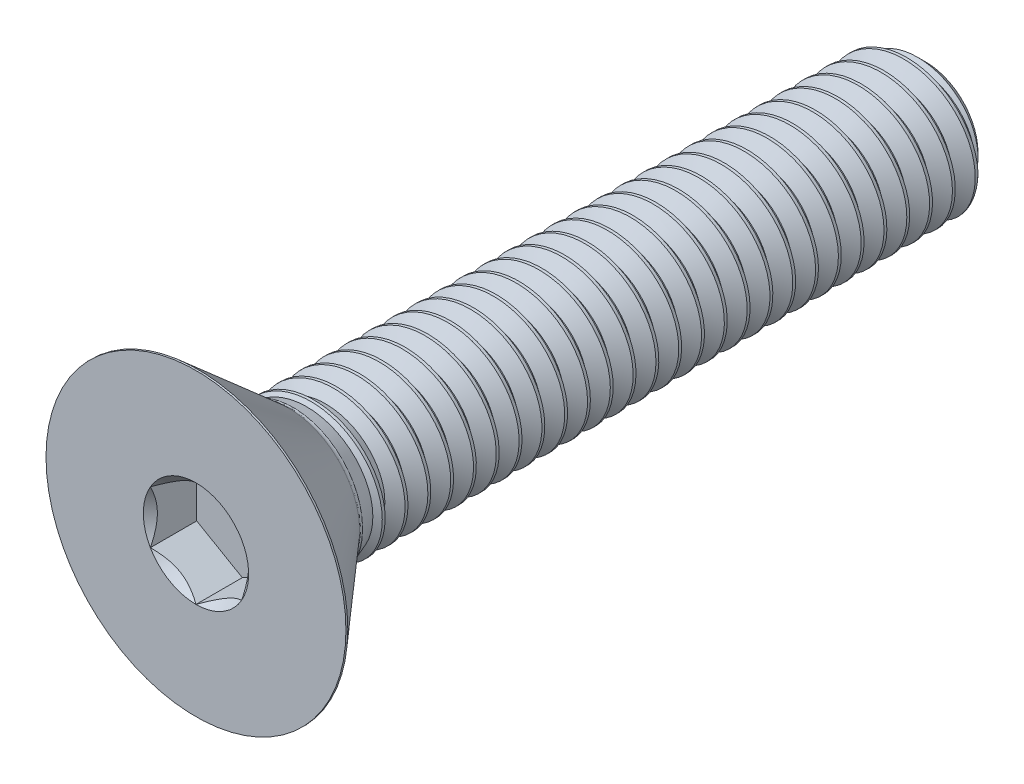
from build123d import *

# Parameters (mm, degrees)
SKETCH5_R          = 1.833087105
CUT_EXTRUDE1_DEPTH = 1.6129
CUT_EXTRUDE1_DRAFT = -45
CUT_EXTRUDE2_DEPTH = 1.6129
CUT_SWEEP1_PITCH   = 0.79375
CUT_SWEEP1_TO      = 22.017366


with BuildPart() as part:
    # Sketch3 → Revolve1 (revolve)
    with BuildSketch(Plane(origin=(0, 0, 0), x_dir=(0, 0, -1), z_dir=(1, 0, 0)), mode=Mode.PRIVATE) as revolve1_sk:
        with BuildLine():
            Line((-12.635484, 5.2197), (-9.4742, 2.471637744))
            ThreePointArc((-9.4742, 2.471637744), (-9.40108483, 2.428138789), (-9.317366229, 2.413))
            Line((-9.317366229, 2.413), (12.1046875, 2.413))
            Line((12.1046875, 2.413), (12.7, 1.8176875))
            Line((12.7, 1.8176875), (12.7, 0))
            Line((12.7, 0), (-12.7, 0))
            Line((-12.7, 0), (-12.7, 5.2197))
            Line((-12.7, 5.2197), (-12.635484, 5.2197))
        make_face()
    revolve(revolve1_sk.sketch.rotate(Axis((0, 0, -12.7), (0, 0, 1)), 90), axis=Axis((0, 0, -12.7), (0, 0, 1)))


with BuildPart() as cut_extrude1_tool:
    # Sketch5 → Cut-Extrude1 (with draft: the straight prism first)
    with BuildSketch(Plane.XY.offset(12.7)):
        Circle(SKETCH5_R)
    extrude(amount=-CUT_EXTRUDE1_DEPTH)
    # Cut-Extrude1: the draft: its side faces are tilted about the plane it starts from
    cut_extrude1_sides = [cut_extrude1_tool.faces().sort_by_distance(p)[0] for p in [
        (-1.833087105, 0, 11.89355),
    ]]
    draft(cut_extrude1_sides, Plane.XY.offset(12.7), CUT_EXTRUDE1_DRAFT)


with BuildPart() as part_1:
    add(part.part)

    # Cut-Extrude1: cut by cut_extrude1_tool
    add(cut_extrude1_tool.part, mode=Mode.SUBTRACT)

    # Sketch4 → Cut-Extrude2 (cut)
    with BuildSketch(Plane.XY.offset(12.7)):
        Polygon((1.5875, -0.916543552), (1.5875, 0.916543552), (0, 1.833087105), (-1.5875, 0.916543552), (-1.5875, -0.916543552), (0, -1.833087105), align=None)
    extrude(amount=-CUT_EXTRUDE2_DEPTH, mode=Mode.SUBTRACT)


with BuildPart() as body_2:
    # Split1: the piece on the far side of the plane
    add(part_1.part)
    split(bisect_by=Plane.XY.offset(9.317366229), keep=Keep.BOTTOM)

    # Cut-Sweep1: arcs per turn and ends read off the stored shape
    # Cut-Sweep1: the profile of Sketch7 screwed along a right-hand helix through 32 turns, 8 arcs to a turn; built about Z, then put on its axis
    cut_sweep1_z = Axis((0, 0, 0), (0, 0, 1))
    cut_sweep1_corners = [(2.455962979, 0, 0.024804688), (2.455962979, 0, -0.719335937), (1.897444252, 0, -0.396875), (1.897444252, 0, -0.29765625)]
    with BuildLine(mode=Mode.PRIVATE) as cut_sweep1_profile:
        Line(cut_sweep1_corners[0], cut_sweep1_corners[1])
        Line(cut_sweep1_corners[1], cut_sweep1_corners[2])
        Line(cut_sweep1_corners[2], cut_sweep1_corners[3])
        Line(cut_sweep1_corners[3], cut_sweep1_corners[0])
    cut_sweep1_cap = Face(cut_sweep1_profile.wire())
    cut_sweep1_turn_angles = [0, 22.5, 45, 67.5, 90, 112.5, 135, 157.5, 180, 202.5, 225, 247.5, 270, 292.5, 315, 337.5, 360]
    cut_sweep1_turn_weights = [1, 0.9238795325112867, 1, 0.9238795325112867, 1, 0.9238795325112867, 1, 0.9238795325112867, 1, 0.9238795325112867, 1, 0.9238795325112867, 1, 0.9238795325112867, 1, 0.9238795325112867, 1]
    cut_sweep1_turn_rails = [Edge.make_bspline([Vector(p[0], p[1], 0).rotate(cut_sweep1_z, cut_sweep1_turn_angles[k]) / cut_sweep1_turn_weights[k] + Vector(0, 0, p[2] + CUT_SWEEP1_PITCH * cut_sweep1_turn_angles[k] / 360) for k in range(17)], [0, 0, 0, 1, 1, 2, 2, 3, 3, 4, 4, 5, 5, 6, 6, 7, 7, 8, 8, 8], 2, cut_sweep1_turn_weights) for p in cut_sweep1_corners]
    cut_sweep1_turn_sides = [Face.make_surface_from_curves(cut_sweep1_turn_rails[p[0]], cut_sweep1_turn_rails[p[1]]) for p in [(0, 1), (1, 2), (2, 3), (3, 0)]]
    cut_sweep1 = Plane(origin=(0, 0, -12.7), x_dir=(0, 1, 0), z_dir=(0, 0, 1)) * split(Solid(Shell([*[p.moved(Location((0, 0, CUT_SWEEP1_PITCH * i))) for i in range(32) for p in cut_sweep1_turn_sides], cut_sweep1_cap, cut_sweep1_cap.rotate(cut_sweep1_z, 11520).moved(Location((0, 0, CUT_SWEEP1_PITCH * 11520 / 360)))])), bisect_by=Plane.XY.offset(CUT_SWEEP1_TO), keep=Keep.BOTTOM, mode=Mode.PRIVATE)
    add(cut_sweep1, mode=Mode.SUBTRACT)


with BuildPart() as part_2:
    add(part_1.part)

    # Split1
    split(bisect_by=Plane.XY.offset(9.317366229), keep=Keep.TOP)

    add(body_2.part)  # Boss-Extrude1 merges body 2
    # Boss-Extrude1 cone 1 section (through the dimple's axis) → Boss-Extrude1 (revolve)
    with BuildSketch(Plane(origin=(0, 0, 9.317366229), x_dir=(0, -1, 0), z_dir=(1, 0, 0))):
        Polygon((0, 0), (2.413, 0), (0, 6.629663013), align=None)
    revolve(axis=Axis((0, 0, 9.317366229), (0, 0, -1)))


solid = part_2.part
